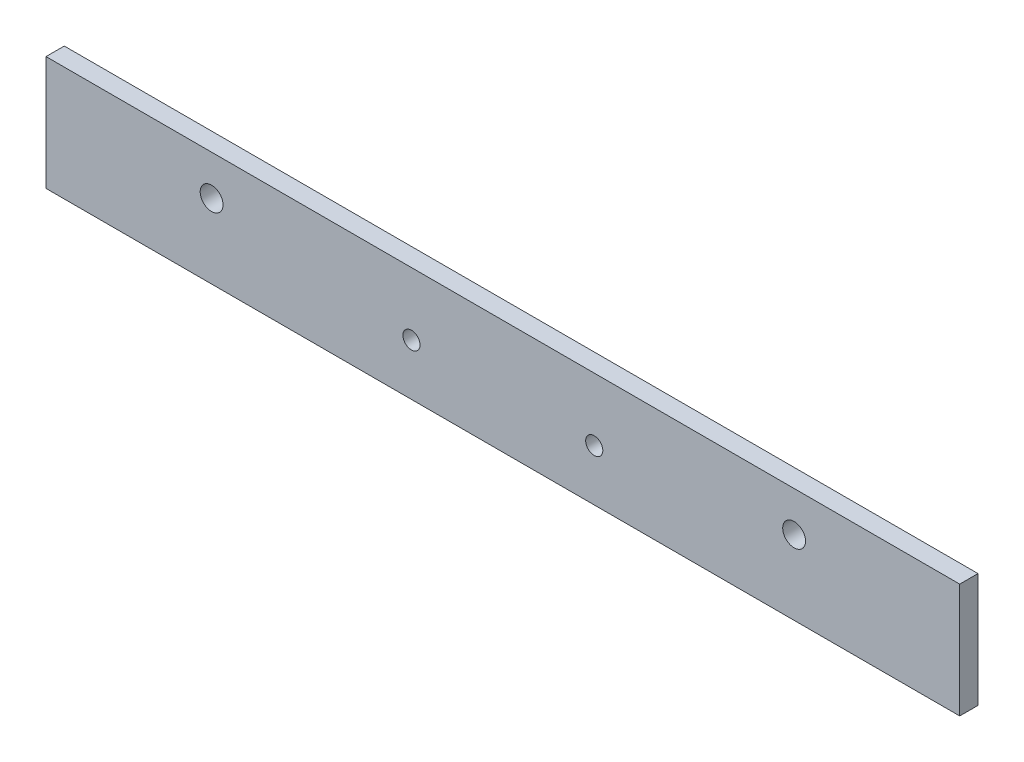
from build123d import *

# Parameters (mm, degrees)
SKETCH2_W               = 160
SKETCH2_H               = 20
BOSS_EXTRUDE1_DEPTH     = 3.2
CUT_EXTRUDE1_DEPTH      = 162.276904732
CUT_EXTRUDE1_DEPTH_BACK = 162.276904732
SKETCH5_R               = 2
SKETCH6_R               = 1.5
CUT_EXTRUDE2_DEPTH      = 10


with BuildPart() as part:
    # Sketch2 → Boss-Extrude1 (new body)
    with BuildSketch(Plane(origin=(0, -10, 10), x_dir=(1, 0, 0), z_dir=(0, 0, -1))):
        with Locations((80, 0)):
            Rectangle(SKETCH2_W, SKETCH2_H)
    extrude(amount=BOSS_EXTRUDE1_DEPTH)

    # Sketch5 → Cut-Extrude1 (cut, two sides: drawn at the far end of the back side and taken through both)
    with BuildSketch(Plane.XY.offset(10).offset(-CUT_EXTRUDE1_DEPTH_BACK)):
        with Locations((131, -7)):
            Circle(SKETCH5_R)
        with Locations((29, -7)):
            Circle(SKETCH5_R)
    extrude(amount=CUT_EXTRUDE1_DEPTH + CUT_EXTRUDE1_DEPTH_BACK, mode=Mode.SUBTRACT)

    # Sketch6 → Cut-Extrude2 (cut)
    with BuildSketch(Plane.XY.offset(10)):
        with Locations((96, -11)):
            Circle(SKETCH6_R)
        with Locations((64, -11)):
            Circle(SKETCH6_R)
    extrude(amount=-CUT_EXTRUDE2_DEPTH, mode=Mode.SUBTRACT)


solid = part.part
